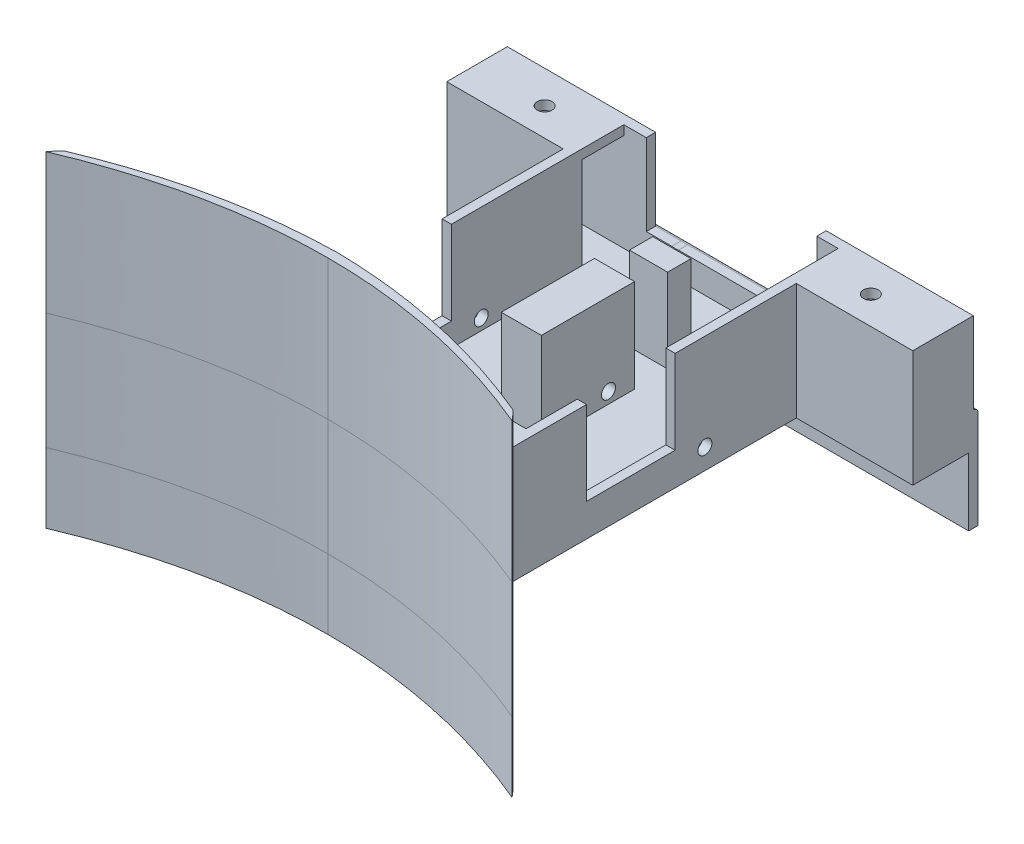
from build123d import *

# Parameters (mm, degrees)
SALIENTE_EXTRUIR1_DEPTH  = 25
VACIADO1_START           = 2
VACIADO1_DEPTH           = 23
CROQUIS3_W               = 10
CROQUIS3_H               = 18
CROQUIS3_W_2             = 5
CORTAR_EXTRUIR3_DEPTH    = 63
CROQUIS5_W               = 8.6
CROQUIS5_H               = 20
SALIENTE_EXTRUIR2_DEPTH  = 20
CROQUIS9_W               = 25
CROQUIS9_H               = 9
SALIENTE_EXTRUIR5_DEPTH  = 2
CORTAR_EXTRUIR4_DEPTH    = 13
SALIENTE_EXTRUIR8_DEPTH  = 30
SALIENTE_EXTRUIR9_DEPTH  = 15
SALIENTE_EXTRUIR11_REACH = 103.42
CROQUIS17_W              = 46
CROQUIS17_H              = 1
CORTAR_EXTRUIR5_REACH    = 83.24
CROQUIS18_W              = 26.5
CROQUIS18_H              = 17.5
CROQUIS19_R              = 1.5
CORTAR_EXTRUIR6_DEPTH    = 60
CROQUIS20_R              = 1.6
CORTAR_EXTRUIR7_DEPTH    = 82.240384219
CROQUIS21_W              = 4
CROQUIS21_H              = 18
CORTAR_EXTRUIR8_DEPTH    = 2
CROQUIS22_W              = 4
CROQUIS22_H              = 18
CORTAR_EXTRUIR9_DEPTH    = 2
CROQUIS23_W              = 36.597932746
CROQUIS23_H              = 17.450550814
CORTAR_EXTRUIR10_DEPTH   = 2
CROQUIS25_W              = 44.080721066
CROQUIS25_H              = 4.2
SALIENTE_EXTRUIR12_DEPTH = 18
CROQUIS29_W              = 3.5
CROQUIS29_H              = 4.2
CORTAR_EXTRUIR11_DEPTH   = 18
CROQUIS34_W              = 3.5
CROQUIS34_H              = 4.2
CORTAR_EXTRUIR12_DEPTH   = 18
CROQUIS35_W              = 8.2
CROQUIS35_H              = 5
SALIENTE_EXTRUIR13_DEPTH = 18
CROQUIS49_W              = 100
CROQUIS49_H              = 2
SALIENTE_EXTRUIR20_DEPTH = 14.5
CROQUIS50_W              = 100
CROQUIS50_H              = 1
SALIENTE_EXTRUIR21_DEPTH = 7.5
REDONDEO3_R              = 1


# Read off the part's stored shape, not the designer's step: Vaciado1, Saliente-Extruir8, Saliente-Extruir9
with BuildPart() as part:
    # Croquis1 → Saliente-Extruir1 (new body)
    with BuildSketch(Plane(origin=(0, 0, 0), x_dir=(1, 0, 0), z_dir=(0, 1, 0))):
        with BuildLine():
            Line((-50, 50), (50, 50))
            Line((50, 50), (50, 37))
            Line((50, 37), (25, 37))
            Line((25, 37), (25, -37))
            ThreePointArc((25, -37), (38.865424624, -40.155365367), (50, -49))
            add(Edge.make_bspline(
                [(50, -49), (25.069665495, -38.5), (0, -38.5)],
                knots=[0, 0, 0, 0.487509827, 0.487509827, 0.487509827], degree=2))
            add(Edge.make_bspline(
                [(-50, -49), (-25.069665495, -38.5), (0, -38.5)],
                knots=[0, 0, 0, 0.487509827, 0.487509827, 0.487509827], degree=2))
            ThreePointArc((-50, -49), (-38.865424624, -40.155365367), (-25, -37))
            Line((-25, -37), (-25, 37))
            Line((-25, 37), (-50, 37))
            Line((-50, 37), (-50, 50))
        make_face()
    extrude(amount=SALIENTE_EXTRUIR1_DEPTH)

    # Vaciado1 outline → Vaciado1 (cut)
    with BuildSketch(Plane(origin=(0, 0, 0), x_dir=(1, 0, 0), z_dir=(0, 1, 0)).offset(VACIADO1_START)):
        with BuildLine():
            ThreePointArc((40.360732069, -43.224043879), (32.7940153, -40.028651284), (24.64466366, -39.002101553))
            add(Edge.make_bspline(
                [(24.64466366, -39.002101553), (27.267975688, -39.535570601), (29.889798454, -40.137194866), (32.510049946, -40.806919812), (35.128659178, -41.544682347), (37.745568283, -42.350413884), (40.360732069, -43.224043879)],
                knots=[0.23606502, 0.23606502, 0.23606502, 0.23606502, 0.23606502, 0.23606502, 0.23606502, 0.387124221, 0.387124221, 0.387124221, 0.387124221, 0.387124221, 0.387124221, 0.387124221], degree=6))
        make_face()
        with BuildLine():
            ThreePointArc((-24.64466366, -39.002101553), (-32.7940153, -40.028651284), (-40.360732069, -43.224043879))
            add(Edge.make_bspline(
                [(-40.360732069, -43.224043879), (-37.745568283, -42.350413884), (-35.128659178, -41.544682347), (-32.510049946, -40.806919812), (-29.889798454, -40.137194866), (-27.267975688, -39.535570601), (-24.64466366, -39.002101553)],
                knots=[0.100385605, 0.100385605, 0.100385605, 0.100385605, 0.100385605, 0.100385605, 0.100385605, 0.251444807, 0.251444807, 0.251444807, 0.251444807, 0.251444807, 0.251444807, 0.251444807], degree=6))
        make_face()
        with BuildLine():
            Line((-23, 39), (-23.000000008, -38.678856831))
            add(Edge.make_bspline(
                [(-23.000000008, -38.678856831), (-19.173415883, -37.952848249), (-15.343739175, -37.371820066), (-11.511234649, -36.93593302), (-7.676214778, -36.645306639), (-3.839024177, -36.5), (3.839024177, -36.5), (7.676214778, -36.645306639), (11.511234649, -36.93593302), (15.343739175, -37.371820066), (19.173415883, -37.952848249), (23.000000008, -38.678856831)],
                knots=[0.267226703, 0.267226703, 0.267226703, 0.267226703, 0.267226703, 0.267226703, 0.267226703, 0.487509827, 0.487509827, 0.487509827, 0.487509827, 0.487509827, 0.70779295, 0.70779295, 0.70779295, 0.70779295, 0.70779295, 0.70779295, 0.70779295], degree=6))
            Line((23.000000008, -38.678856831), (23, 39))
            Line((23, 39), (48, 39))
            Line((48, 39), (48, 48))
            Line((48, 48), (-48, 48))
            Line((-48, 48), (-48, 39))
            Line((-48, 39), (-23, 39))
        make_face()
    extrude(amount=VACIADO1_DEPTH, mode=Mode.SUBTRACT)

    # Croquis3 → Cortar-Extruir3 (cut)
    with BuildSketch(Plane(origin=(25, 0, 0), x_dir=(0, 0, -1), z_dir=(1, 0, 0))):
        with Locations((-3, 16)):
            Rectangle(CROQUIS3_W, CROQUIS3_H)
        with Locations((8.5, 16)):
            Rectangle(CROQUIS3_W_2, CROQUIS3_H)
    extrude(amount=-CORTAR_EXTRUIR3_DEPTH, mode=Mode.SUBTRACT)

    # Croquis5 → Saliente-Extruir2 (add)
    with BuildSketch(Plane(origin=(0, 2, 0), x_dir=(1, 0, 0), z_dir=(0, 1, 0))):
        with Locations((0, 13)):
            Rectangle(CROQUIS5_W, CROQUIS5_H)
    extrude(amount=SALIENTE_EXTRUIR2_DEPTH)

    # Croquis9 → Saliente-Extruir5 (add)
    with BuildSketch(Plane(origin=(0, 25, 0), x_dir=(1, 0, 0), z_dir=(0, 1, 0))):
        with Locations((-35.5, 43.5)):
            Rectangle(CROQUIS9_W, CROQUIS9_H)
        with Locations((35.5, 43.5)):
            Rectangle(CROQUIS9_W, CROQUIS9_H)
    extrude(amount=-SALIENTE_EXTRUIR5_DEPTH)

    # Croquis2 → Cortar-Extruir4 (cut)
    with BuildSketch(Plane(origin=(0, 0, -50), x_dir=(-1, 0, 0), z_dir=(0, 0, -1))):
        with BuildLine():
            Line((17, 25), (7, 25))
            Line((7, 25), (7, 12.5))
            ThreePointArc((7, 12.5), (12, 7.5), (17, 12.5))
            Line((17, 12.5), (17, 25))
        make_face()
        with BuildLine():
            Line((-7, 12.5), (-7, 25))
            Line((-7, 25), (-17, 25))
            Line((-17, 25), (-17, 12.5))
            ThreePointArc((-17, 12.5), (-12, 7.5), (-7, 12.5))
        make_face()
    extrude(amount=-CORTAR_EXTRUIR4_DEPTH, mode=Mode.SUBTRACT)

    # Saliente-Extruir8 outline → Saliente-Extruir8 (add)
    with BuildSketch(Plane(origin=(0, 25, 0), x_dir=(1, 0, 0), z_dir=(0, 1, 0))):
        with BuildLine():
            ThreePointArc((-48.178880722, -46.919101462), (-49.111898963, -47.93989586), (-50, -49))
            add(Edge.make_bspline(
                [(-50, -49), (-25.069665493, -38.499999999), (4e-09, -38.5)],
                knots=[0.498431068, 0.498431068, 0.498431068, 0.500051325, 0.500051325, 0.500051325], degree=2))
            add(Edge.make_bspline(
                [(4e-09, -38.5), (25.069665495, -38.5), (50, -49)],
                knots=[0.499948675, 0.499948675, 0.499948675, 0.501568932, 0.501568932, 0.501568932], degree=2))
            ThreePointArc((50, -49), (49.111898963, -47.93989586), (48.178880723, -46.919101462))
            add(Edge.make_bspline(
                [(48.178880723, -46.919101462), (46.858484554, -46.365008442), (43.431854572, -44.984489744), (35.841757624, -42.260105988), (25.339635276, -39.32719595), (12.69476254, -37.138472388), (4.23860402, -36.564965521), (0, -36.5)],
                knots=[0.500023061, 0.500023061, 0.500023061, 0.500023061, 0.500151208, 0.50035374, 0.500758804, 0.501163868, 0.501568932, 0.501568932, 0.501568932, 0.501568932], degree=3))
            add(Edge.make_bspline(
                [(0, -36.5), (-4.23860402, -36.564965521), (-12.69476254, -37.138472388), (-25.339635276, -39.32719595), (-35.841757623, -42.260105987), (-43.431854572, -44.984489744), (-46.858484554, -46.365008441), (-48.178880722, -46.919101462)],
                knots=[0.498431068, 0.498431068, 0.498431068, 0.498431068, 0.498836132, 0.499241196, 0.49964626, 0.499848792, 0.499976939, 0.499976939, 0.499976939, 0.499976939], degree=3))
        make_face()
    extrude(amount=SALIENTE_EXTRUIR8_DEPTH)

    # Saliente-Extruir9 outline → Saliente-Extruir9 (add)
    with BuildSketch(Plane.XZ):
        with BuildLine():
            add(Edge.make_bspline(
                [(-48.178880722, 46.919101462), (-46.858484554, 46.365008441), (-43.431854571, 44.984489743), (-35.841757623, 42.260105987), (-25.339635276, 39.32719595), (-12.694762539, 37.138472388), (-4.23860402, 36.564965521), (0, 36.5)],
                knots=[0.498505454, 0.498505454, 0.498505454, 0.498505454, 0.4986336, 0.498836132, 0.499241196, 0.49964626, 0.500051325, 0.500051325, 0.500051325, 0.500051325], degree=3))
            add(Edge.make_bspline(
                [(0, 36.5), (4.23860402, 36.564965521), (12.69476254, 37.138472388), (25.339635276, 39.32719595), (35.841757624, 42.260105988), (43.431854572, 44.984489744), (46.858484554, 46.365008442), (48.178880723, 46.919101462)],
                knots=[0.499948675, 0.499948675, 0.499948675, 0.499948675, 0.50035374, 0.500758804, 0.501163868, 0.5013664, 0.501494546, 0.501494546, 0.501494546, 0.501494546], degree=3))
            ThreePointArc((48.178880723, 46.919101462), (49.111898963, 47.93989586), (50, 49))
            add(Edge.make_bspline(
                [(50, 49), (25.069665495, 38.5), (0, 38.5)],
                knots=[0.498431068, 0.498431068, 0.498431068, 0.500051325, 0.500051325, 0.500051325], degree=2))
            add(Edge.make_bspline(
                [(0, 38.5), (-25.069665486, 38.499999997), (-50, 49)],
                knots=[0.499948675, 0.499948675, 0.499948675, 0.501568932, 0.501568932, 0.501568932], degree=2))
            ThreePointArc((-50, 49), (-49.111898963, 47.93989586), (-48.178880722, 46.919101462))
        make_face()
    extrude(amount=SALIENTE_EXTRUIR9_DEPTH)

    # Croquis17 → Saliente-Extruir11 (add, up to next)
    with BuildSketch(Plane.XY.offset(19), mode=Mode.PRIVATE) as saliente_extruir11_sk1:
        with Locations((0, 24.5)):
            Rectangle(CROQUIS17_W, CROQUIS17_H)
    saliente_extruir11_tool1 = extrude(saliente_extruir11_sk1.sketch, amount=SALIENTE_EXTRUIR11_REACH, mode=Mode.PRIVATE) - part.part
    add(saliente_extruir11_tool1.solids().sort_by_distance((0, 24.5, 19))[0])

    # Croquis18 → Cortar-Extruir5 (cut, up to next)
    with BuildSketch(Plane(origin=(0, 25, 0), x_dir=(1, 0, 0), z_dir=(0, 1, 0)), mode=Mode.PRIVATE) as cortar_extruir5_sk1:
        with Locations((0, -27.75)):
            Rectangle(CROQUIS18_W, CROQUIS18_H)
    cortar_extruir5_tool1 = extrude(cortar_extruir5_sk1.sketch, amount=-CORTAR_EXTRUIR5_REACH, mode=Mode.PRIVATE) & part.part
    add(cortar_extruir5_tool1.solids().sort_by_distance((0, 25, 27.75))[0], mode=Mode.SUBTRACT)

    # Croquis19 → Cortar-Extruir6 (cut)
    with BuildSketch(Plane(origin=(25, 0, 0), x_dir=(0, 0, -1), z_dir=(1, 0, 0))):
        with Locations((17.4, 4.4)):
            Circle(CROQUIS19_R)
    extrude(amount=-CORTAR_EXTRUIR6_DEPTH, mode=Mode.SUBTRACT)

    # Croquis20 → Cortar-Extruir7 (cut, through all)
    with BuildSketch(Plane(origin=(0, 25, 0), x_dir=(1, 0, 0), z_dir=(0, 1, 0))):
        with Locations(Location((-35, 43, 0), (0, 0, 270))):
            Circle(CROQUIS20_R)
        with Locations(Location((-20, -30, 0), (0, 0, 270))):
            Circle(CROQUIS20_R)
        with Locations(Location((20, -30, 0), (0, 0, 270))):
            Circle(CROQUIS20_R)
        with Locations(Location((35, 43, 0), (0, 0, 90))):
            Circle(CROQUIS20_R)
    extrude(amount=-CORTAR_EXTRUIR7_DEPTH, mode=Mode.SUBTRACT)

    # Croquis21 → Cortar-Extruir8 (cut)
    with BuildSketch(Plane(origin=(25, 0, 0), x_dir=(0, 0, -1), z_dir=(1, 0, 0))):
        with Locations((4, 16)):
            Rectangle(CROQUIS21_W, CROQUIS21_H)
    extrude(amount=-CORTAR_EXTRUIR8_DEPTH, mode=Mode.SUBTRACT)

    # Croquis22 → Cortar-Extruir9 (cut)
    with BuildSketch(Plane.ZY.offset(25)):
        with Locations((-4, 16)):
            Rectangle(CROQUIS22_W, CROQUIS22_H)
    extrude(amount=-CORTAR_EXTRUIR9_DEPTH, mode=Mode.SUBTRACT)

    # Croquis23 → Cortar-Extruir10 (cut)
    with BuildSketch(Plane(origin=(0, 0, -50), x_dir=(-1, 0, 0), z_dir=(0, 0, -1))):
        with Locations((-0.109574649, 16.274724593)):
            Rectangle(CROQUIS23_W, CROQUIS23_H)
    extrude(amount=-CORTAR_EXTRUIR10_DEPTH, mode=Mode.SUBTRACT)

    # Croquis25 → Saliente-Extruir12 (add)
    with BuildSketch(Plane(origin=(0, 2, 0), x_dir=(1, 0, 0), z_dir=(0, 1, 0))):
        with Locations((0.140384462, -16.141325676)):
            Rectangle(CROQUIS25_W, CROQUIS25_H)
    extrude(amount=SALIENTE_EXTRUIR12_DEPTH)

    # Croquis29 → Cortar-Extruir11 (cut)
    with BuildSketch(Plane(origin=(0, 20, 0), x_dir=(1, 0, 0), z_dir=(0, 1, 0))):
        with Locations((12.780744995, -16.141325676)):
            Rectangle(CROQUIS29_W, CROQUIS29_H)
    extrude(amount=-CORTAR_EXTRUIR11_DEPTH, mode=Mode.SUBTRACT)

    # Croquis34 → Cortar-Extruir12 (cut)
    with BuildSketch(Plane(origin=(0, 20, 0), x_dir=(1, 0, 0), z_dir=(0, 1, 0))):
        with Locations((-12.499976071, -16.141325676)):
            Rectangle(CROQUIS34_W, CROQUIS34_H)
    extrude(amount=-CORTAR_EXTRUIR12_DEPTH, mode=Mode.SUBTRACT)

    # Croquis35 → Saliente-Extruir13 (add)
    with BuildSketch(Plane(origin=(0, 2, 0), x_dir=(1, 0, 0), z_dir=(0, 1, 0))):
        with Locations((0, 32.8)):
            Rectangle(CROQUIS35_W, CROQUIS35_H)
    extrude(amount=SALIENTE_EXTRUIR13_DEPTH)

    # Croquis49 → Saliente-Extruir20 (add)
    with BuildSketch(Plane.XZ):
        with Locations((0, -50)):
            Rectangle(CROQUIS49_W, CROQUIS49_H)
    extrude(amount=SALIENTE_EXTRUIR20_DEPTH)

    # Croquis50 → Saliente-Extruir21 (add)
    with BuildSketch(Plane(origin=(0, 0, 0), x_dir=(1, 0, 0), z_dir=(0, 1, 0))):
        with Locations((0, 50.5)):
            Rectangle(CROQUIS50_W, CROQUIS50_H)
    extrude(amount=SALIENTE_EXTRUIR21_DEPTH)

    # Redondeo3
    redondeo3_edges = [part.edges().sort_by_distance(p)[0] for p in [
        (0, 7.5, -51),
    ]]
    fillet(redondeo3_edges, radius=REDONDEO3_R - 0.0001)  # a hair under: the kernel refuses the full size


solid = part.part
